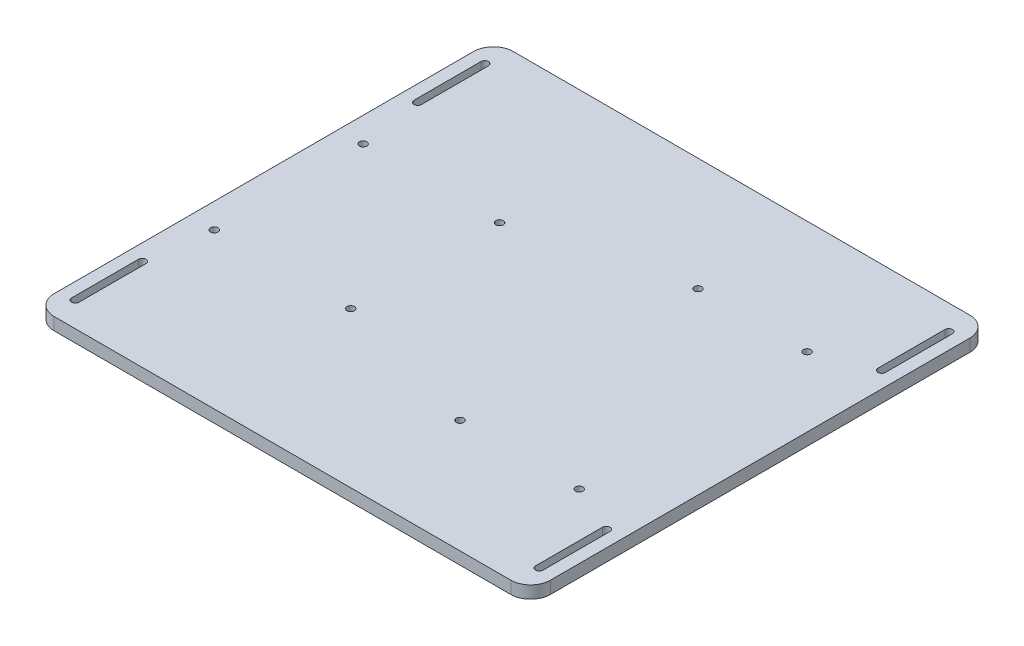
from build123d import *

# Parameters (mm, degrees)
SKETCH2_W           = 200
SKETCH2_H           = 185
BOSS_EXTRUDE1_DEPTH = 5
SKETCH3_R           = 1.5
CUT_EXTRUDE1_DEPTH  = 137.313058802
SKETCH4_R           = 1.5
CUT_EXTRUDE3_DEPTH  = 137.313058802
FILLET1_R           = 8


with BuildPart() as part:
    # Sketch2 → Boss-Extrude1 (new body)
    with BuildSketch(Plane(origin=(0, 0, 0), x_dir=(1, 0, 0), z_dir=(0, 1, 0))):
        Rectangle(SKETCH2_W, SKETCH2_H)
        with BuildLine():
            Line((-95, 55.5), (-95, 82.5))
            ThreePointArc((-95, 82.5), (-93.5, 84), (-92, 82.5))
            Line((-92, 82.5), (-92, 55.5))
            ThreePointArc((-92, 55.5), (-93.5, 54), (-95, 55.5))
        make_face(mode=Mode.SUBTRACT)
        with BuildLine():
            Line((95, 55.5), (95, 82.5))
            ThreePointArc((95, 82.5), (93.5, 84), (92, 82.5))
            Line((92, 82.5), (92, 55.5))
            ThreePointArc((92, 55.5), (93.5, 54), (95, 55.5))
        make_face(mode=Mode.SUBTRACT)
        with BuildLine():
            Line((95, -55.5), (95, -82.5))
            ThreePointArc((95, -82.5), (93.5, -84), (92, -82.5))
            Line((92, -82.5), (92, -55.5))
            ThreePointArc((92, -55.5), (93.5, -54), (95, -55.5))
        make_face(mode=Mode.SUBTRACT)
        with BuildLine():
            Line((-95, -55.5), (-95, -82.5))
            ThreePointArc((-95, -82.5), (-93.5, -84), (-92, -82.5))
            Line((-92, -82.5), (-92, -55.5))
            ThreePointArc((-92, -55.5), (-93.5, -54), (-95, -55.5))
        make_face(mode=Mode.SUBTRACT)
    extrude(amount=BOSS_EXTRUDE1_DEPTH)

    # Sketch3 → Cut-Extrude1 (cut, through all)
    with BuildSketch(Plane(origin=(0, 5, 0), x_dir=(1, 0, 0), z_dir=(0, 1, 0))):
        with Locations((-90, -30)):
            Circle(SKETCH3_R)
        with Locations((-90, 30)):
            Circle(SKETCH3_R)
        with Locations((-35, 30)):
            Circle(SKETCH3_R)
        with Locations((-35, -30)):
            Circle(SKETCH3_R)
    extrude(amount=-CUT_EXTRUDE1_DEPTH, mode=Mode.SUBTRACT)

    # Sketch4 → Cut-Extrude3 (cut, through all)
    with BuildSketch(Plane(origin=(0, 5, 0), x_dir=(1, 0, 0), z_dir=(0, 1, 0))):
        with Locations((28, 46.935)):
            Circle(SKETCH4_R)
        with Locations((72, 46.935)):
            Circle(SKETCH4_R)
        with Locations((26, -46.935)):
            Circle(SKETCH4_R)
        with Locations((74, -46.935)):
            Circle(SKETCH4_R)
    extrude(amount=-CUT_EXTRUDE3_DEPTH, mode=Mode.SUBTRACT)

    # Fillet1
    fillet1_edges = [part.edges().sort_by_distance(p)[0] for p in [
        (100, 2.5, -92.5),
        (100, 2.5, 92.5),
        (-100, 2.5, -92.5),
        (-100, 2.5, 92.5),
    ]]
    fillet(fillet1_edges, radius=FILLET1_R)


solid = part.part
